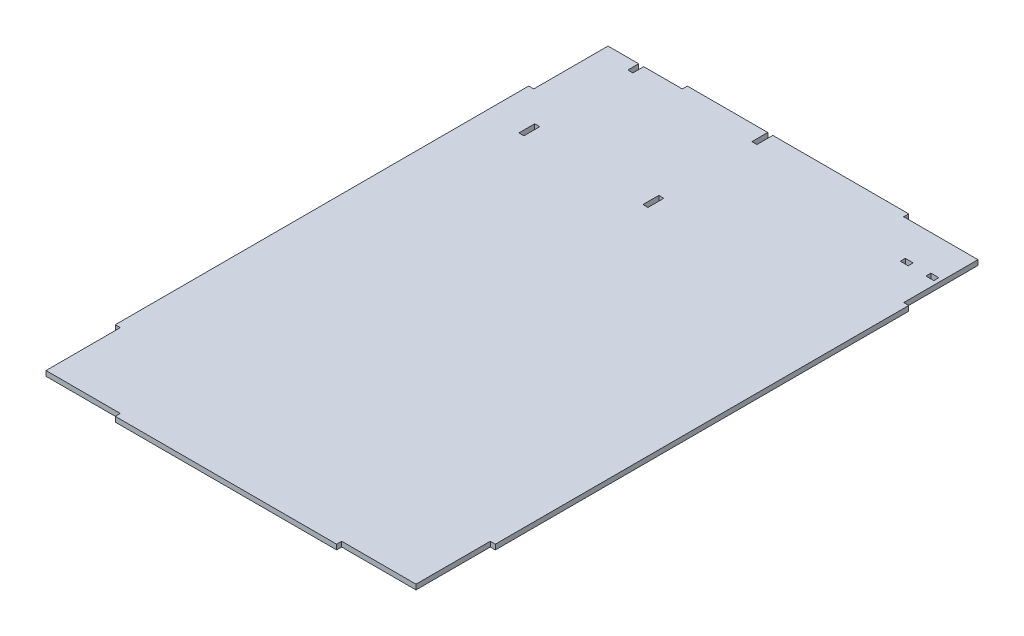
from build123d import *

# Parameters (mm, degrees)
SKETCH1_W           = 479
SKETCH1_H           = 721
BOSS_EXTRUDE1_DEPTH = 3.175
CUT_EXTRUDE1_DEPTH  = 433.851963724
SKETCH3_W           = 6.35
SKETCH3_H           = 20
SKETCH3_W_2         = 10
SKETCH3_H_2         = 6.35
CUT_EXTRUDE2_DEPTH  = 433.851963724


with BuildPart() as part:
    # Sketch1 → Boss-Extrude1 (new, symmetric)
    with BuildSketch(Plane(origin=(0, 0, 0), x_dir=(1, 0, 0), z_dir=(0, 1, 0))):
        Rectangle(SKETCH1_W, SKETCH1_H)
    extrude(amount=BOSS_EXTRUDE1_DEPTH, both=True)

    # Sketch2 → Cut-Extrude1 (cut, through all)
    with BuildSketch(Plane(origin=(0, 3.175, 0), x_dir=(1, 0, 0), z_dir=(0, 1, 0))):
        Polygon((-239.5, 360.5), (-239.5, 260.5), (-233.15, 260.5), (-233.15, 354.15), (-139.5, 354.15), (-139.5, 360.5), align=None)
        Polygon((239.5, 360.5), (139.5, 360.5), (139.5, 354.15), (233.15, 354.15), (233.15, 260.5), (239.5, 260.5), align=None)
        Polygon((239.5, -360.5), (239.5, -260.5), (233.15, -260.5), (233.15, -354.15), (139.5, -354.15), (139.5, -360.5), align=None)
        Polygon((-239.5, -360.5), (-139.5, -360.5), (-139.5, -354.15), (-233.15, -354.15), (-233.15, -260.5), (-239.5, -260.5), align=None)
    extrude(amount=-CUT_EXTRUDE1_DEPTH, mode=Mode.SUBTRACT)

    # Sketch3 → Cut-Extrude2 (cut, through all)
    with BuildSketch(Plane.XZ.offset(3.175)):
        with Locations((-34.975, -350.5)):
            Rectangle(SKETCH3_W, SKETCH3_H)
        with Locations((190.85, -306.625)):
            Rectangle(SKETCH3_W_2, SKETCH3_H_2)
        with Locations((223.15, -306.625)):
            Rectangle(SKETCH3_W_2, SKETCH3_H_2)
        with Locations((-191.325, -350.5)):
            Rectangle(SKETCH3_W, SKETCH3_H)
        with Locations((-34.975, -213.15)):
            Rectangle(SKETCH3_W, SKETCH3_H)
        with Locations((-191.325, -213.15)):
            Rectangle(SKETCH3_W, SKETCH3_H)
    extrude(amount=-CUT_EXTRUDE2_DEPTH, mode=Mode.SUBTRACT)


solid = part.part
